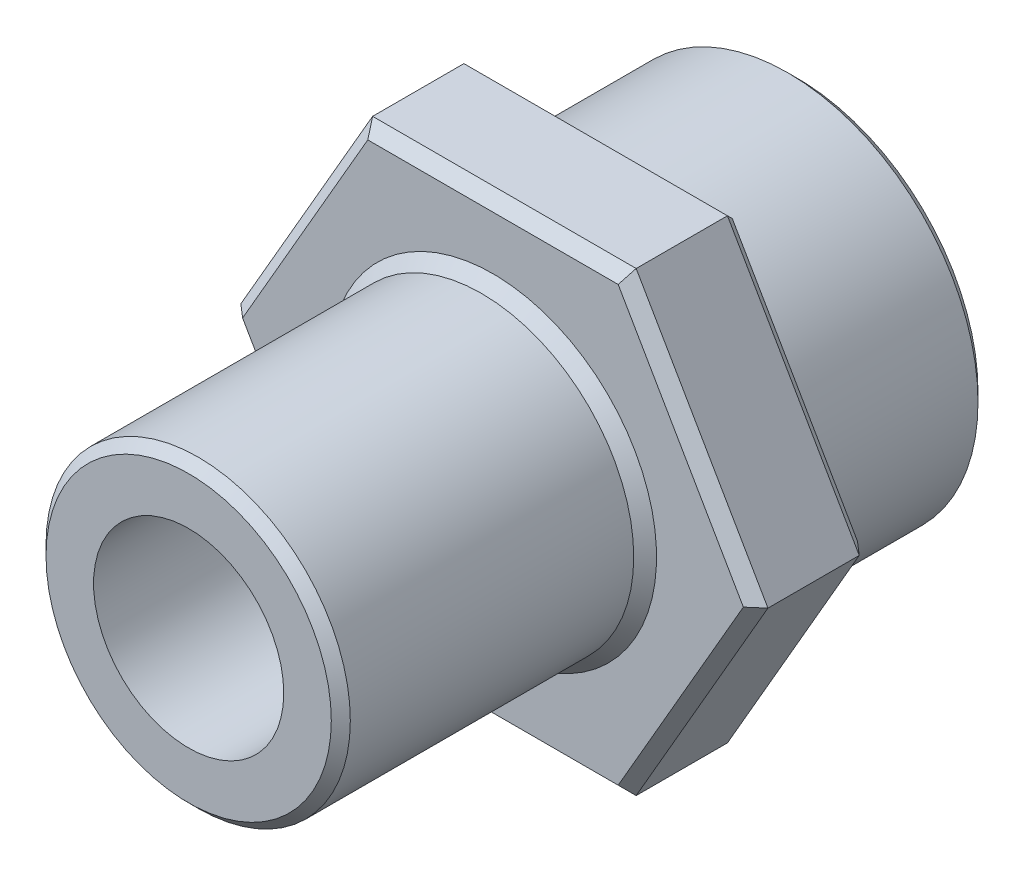
from build123d import *

# Parameters (mm, degrees)
SKETCH1_R           = 4
BOSS_EXTRUDE1_DEPTH = 8
BOSS_EXTRUDE2_DEPTH = 3
SKETCH3_R           = 5
BOSS_EXTRUDE3_DEPTH = 5
SKETCH4_R           = 2.5
CUT_EXTRUDE1_DEPTH  = 19.439088915
CHAMFER1_SIZE       = 0.3
CHAMFER2_SIZE       = 0.3
SKETCH5_W           = 3
SKETCH5_H           = 3
CUT_EXTRUDE2_DEPTH  = 13.165525061
CHAMFER3_SIZE       = 0.3
CHAMFER4_SIZE       = 0.3
CHAMFER5_SIZE       = 0.25


with BuildPart() as part:
    # Sketch1 → Boss-Extrude1 (new body)
    with BuildSketch(Plane.XY):
        Circle(SKETCH1_R)
    extrude(amount=BOSS_EXTRUDE1_DEPTH)

    # Sketch2 → Boss-Extrude2 (add)
    with BuildSketch(Plane(origin=(0, 0, 0), x_dir=(-1, 0, 0), z_dir=(0, 0, -1))):
        Polygon((-3.464101615, 6), (-6.92820323, 0), (-3.464101615, -6), (3.464101615, -6), (6.92820323, 0), (3.464101615, 6), align=None)
    extrude(amount=BOSS_EXTRUDE2_DEPTH)

    # Sketch3 → Boss-Extrude3 (add)
    with BuildSketch(Plane(origin=(0, 0, -3), x_dir=(-1, 0, 0), z_dir=(0, 0, -1))):
        Circle(SKETCH3_R)
    extrude(amount=BOSS_EXTRUDE3_DEPTH)

    # Sketch4 → Cut-Extrude1 (cut, through all)
    with BuildSketch(Plane.XY.offset(8)):
        Circle(SKETCH4_R)
    extrude(amount=-CUT_EXTRUDE1_DEPTH, mode=Mode.SUBTRACT)

    # Chamfer1
    chamfer1_edges = [part.edges().sort_by_distance(p)[0] for p in [
        (-4, 0, 0),
    ]]
    chamfer(chamfer1_edges, length=CHAMFER1_SIZE)

    # Chamfer2
    chamfer2_edges = [part.edges().sort_by_distance(p)[0] for p in [
        (-2.5, 0, -8),
    ]]
    chamfer(chamfer2_edges, length=CHAMFER2_SIZE)

    # Sketch5 → Cut-Extrude2 (cut, through all)
    with BuildSketch(Plane(origin=(0, 0, 0), x_dir=(1, 0, 0), z_dir=(0, 1, 0))):
        with Locations((0, 6.5)):
            Rectangle(SKETCH5_W, SKETCH5_H)
    extrude(amount=-CUT_EXTRUDE2_DEPTH, mode=Mode.SUBTRACT)

    # Chamfer3
    chamfer3_edges = [part.edges().sort_by_distance(p)[0] for p in [
        (-5.196152423, 3, -3),
        (0, 6, 0),
        (5.196152423, 3, 0),
        (5.196152423, -3, 0),
        (0, -6, 0),
        (-5.196152423, -3, 0),
        (-5.196152423, 3, 0),
        (0, 6, -3),
        (5.196152423, 3, -3),
        (5.196152423, -3, -3),
        (0, -6, -3),
        (-5.196152423, -3, -3),
    ]]
    chamfer(chamfer3_edges, length=CHAMFER3_SIZE)

    # Chamfer4
    # the kernel refuses this chamfer: 0.3, 0.239246049 mm, written as the material it takes off along each edge
    with BuildSketch(Plane(origin=(1.5, -1.592813187, -8), x_dir=(0, 0, 1), z_dir=(0, -1, 0))) as chamfer4_piece_1:
        Polygon((CHAMFER4_SIZE, 0), (0, -CHAMFER4_SIZE), (0, 0), align=None)
    extrude(amount=3.948387716, mode=Mode.SUBTRACT)
    with BuildSketch(Plane(origin=(-1.5, -1.592813187, -8), x_dir=(0, 0, 1), z_dir=(0, -1, 0))) as chamfer4_piece_2:
        Polygon((CHAMFER4_SIZE, 0), (0, CHAMFER4_SIZE), (0, 0), align=None)
    extrude(amount=3.948387716, mode=Mode.SUBTRACT)
    with BuildSketch(Plane(origin=(0, 0, -5), x_dir=(-0.44305448610570786, -0.8964946861758898, 0), z_dir=(-0.8964946861758898, 0.44305448610570786, 0))) as chamfer4_piece_3_section:
        Polygon((5, CHAMFER4_SIZE), (5 - CHAMFER4_SIZE, 0), (5, 0), align=None)
    chamfer4_piece_3 = revolve(axis=Axis((0, 0, -5), (0, 0, 1)), revolution_arc=52.597864763, mode=Mode.PRIVATE)
    chamfer4_piece_3 = split(chamfer4_piece_3, bisect_by=Plane(origin=(1.5, 0, -5), z_dir=(-1, 0, 0)), keep=Keep.TOP, mode=Mode.PRIVATE)
    chamfer4_piece_3 = split(chamfer4_piece_3, bisect_by=Plane(origin=(-1.5, 0, -5), z_dir=(1, 0, 0)), keep=Keep.TOP, mode=Mode.PRIVATE)
    add(chamfer4_piece_3, mode=Mode.SUBTRACT)
    with BuildSketch(Plane(origin=(-1.5, -4.769696007, -8.771504896), x_dir=(-0.946580683310887, 0.32246706805919617, 0), z_dir=(0, 0, 1))) as chamfer4_piece_4:
        with BuildLine():
            Line((0.236397724, 0), (CHAMFER4_SIZE * 0.322467068059, -CHAMFER4_SIZE * 0.946580683311))
            Line((CHAMFER4_SIZE * 0.322467068059, -CHAMFER4_SIZE * 0.946580683311), (0, 0))
            ThreePointArc((0, 0), (0.120844642, 0.001396592), (0.236397724, 0))
        make_face()
    extrude(amount=3.771504896, mode=Mode.SUBTRACT)
    with BuildSketch(Plane(origin=(1.5, -4.769696007, -8.771504896), x_dir=(0.9465806833108867, 0.32246706805919695, 0), z_dir=(0, 0, 1))) as chamfer4_piece_5:
        with BuildLine():
            Line((0.236397724, 0), (CHAMFER4_SIZE * 0.322467068059, CHAMFER4_SIZE * 0.946580683311))
            Line((CHAMFER4_SIZE * 0.322467068059, CHAMFER4_SIZE * 0.946580683311), (0, 0))
            ThreePointArc((0, 0), (0.120844642, -0.001396592), (0.236397724, 0))
        make_face()
    extrude(amount=3.771504896, mode=Mode.SUBTRACT)
    with BuildSketch(Plane(origin=(-1.5, -4.769696007, -8.771504896), x_dir=(-0.946580683310887, 0.32246706805919617, 0), z_dir=(0, 0, 1))) as chamfer4_piece_6a_section:
        with BuildLine():
            Line((0.236397724, 0), (CHAMFER4_SIZE * 0.322467068059, -CHAMFER4_SIZE * 0.946580683311))
            Line((CHAMFER4_SIZE * 0.322467068059, -CHAMFER4_SIZE * 0.946580683311), (0, 0))
            ThreePointArc((0, 0), (0.120844642, 0.001396592), (0.236397724, 0))
        make_face()
    chamfer4_piece_6a = extrude(amount=4.543009793, mode=Mode.PRIVATE)
    chamfer4_piece_6a = split(chamfer4_piece_6a, bisect_by=Plane(origin=(-1.5, -4.769696007, -5), z_dir=(0, 0, 1)), keep=Keep.TOP, mode=Mode.PRIVATE)
    with BuildSketch(Plane(origin=(0, 0, -5), x_dir=(-0.44305448610570786, -0.8964946861758898, 0), z_dir=(-0.8964946861758898, 0.44305448610570786, 0))) as chamfer4_piece_6b_section:
        Polygon((5, CHAMFER4_SIZE), (5 - CHAMFER4_SIZE, 0), (5, 0), align=None)
    chamfer4_piece_6b = revolve(axis=Axis((0, 0, -5), (0, 0, 1)), revolution_arc=52.597864763, mode=Mode.PRIVATE)
    chamfer4_piece_6b = split(chamfer4_piece_6b, bisect_by=Plane(origin=(-1.5, 0, -5), z_dir=(-1, 0, 0)), keep=Keep.TOP, mode=Mode.PRIVATE)
    chamfer4_piece_6 = chamfer4_piece_6a & chamfer4_piece_6b
    add(chamfer4_piece_6, mode=Mode.SUBTRACT)
    with BuildSketch(Plane(origin=(0, 0, -5), x_dir=(-0.44305448610570786, -0.8964946861758898, 0), z_dir=(-0.8964946861758898, 0.44305448610570786, 0))) as chamfer4_piece_7a_section:
        Polygon((5, CHAMFER4_SIZE), (5 - CHAMFER4_SIZE, 0), (5, 0), align=None)
    chamfer4_piece_7a = revolve(axis=Axis((0, 0, -5), (0, 0, 1)), revolution_arc=52.597864763, mode=Mode.PRIVATE)
    chamfer4_piece_7a = split(chamfer4_piece_7a, bisect_by=Plane(origin=(1.5, 0, -5), z_dir=(1, 0, 0)), keep=Keep.TOP, mode=Mode.PRIVATE)
    with BuildSketch(Plane(origin=(1.5, -4.769696007, -8.771504896), x_dir=(0.9465806833108867, 0.32246706805919695, 0), z_dir=(0, 0, 1))) as chamfer4_piece_7b_section:
        with BuildLine():
            Line((0.236397724, 0), (CHAMFER4_SIZE * 0.322467068059, CHAMFER4_SIZE * 0.946580683311))
            Line((CHAMFER4_SIZE * 0.322467068059, CHAMFER4_SIZE * 0.946580683311), (0, 0))
            ThreePointArc((0, 0), (0.120844642, -0.001396592), (0.236397724, 0))
        make_face()
    chamfer4_piece_7b = extrude(amount=4.543009793, mode=Mode.PRIVATE)
    chamfer4_piece_7b = split(chamfer4_piece_7b, bisect_by=Plane(origin=(1.5, -4.769696007, -5), z_dir=(0, 0, 1)), keep=Keep.TOP, mode=Mode.PRIVATE)
    chamfer4_piece_7 = chamfer4_piece_7a & chamfer4_piece_7b
    add(chamfer4_piece_7, mode=Mode.SUBTRACT)

    # Chamfer5
    chamfer5_edges = [part.edges().sort_by_distance(p)[0] for p in [
        (2.828427125, 4.123105626, -8),
        (-4, 0, 8),
    ]]
    chamfer(chamfer5_edges, length=CHAMFER5_SIZE)


solid = part.part
